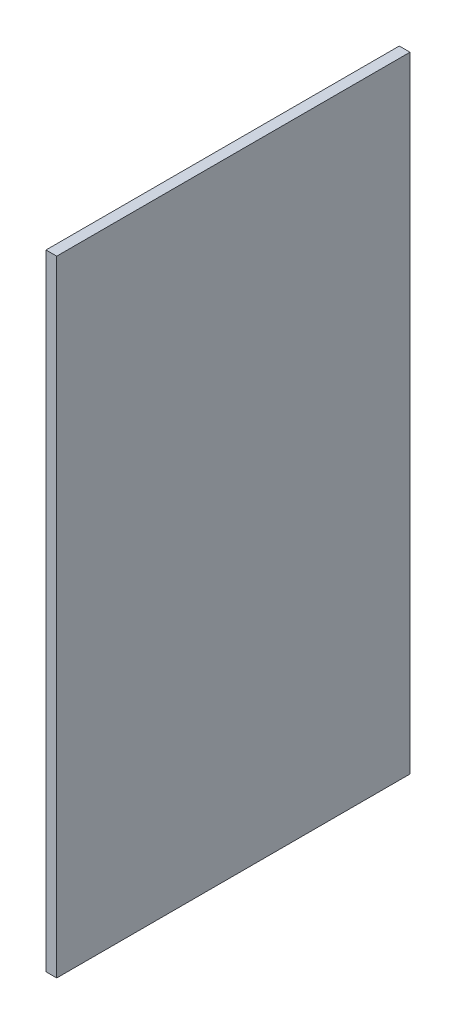
from build123d import *

# Parameters (mm, degrees)
SKETCH1_W           = 185.166039476
SKETCH1_H           = 104.638710046
BOSS_EXTRUDE1_DEPTH = 3.175


with BuildPart() as part:
    # Sketch1 → Boss-Extrude1 (new body)
    with BuildSketch(Plane.YZ):
        Rectangle(SKETCH1_W, SKETCH1_H)
    extrude(amount=BOSS_EXTRUDE1_DEPTH)


solid = part.part
